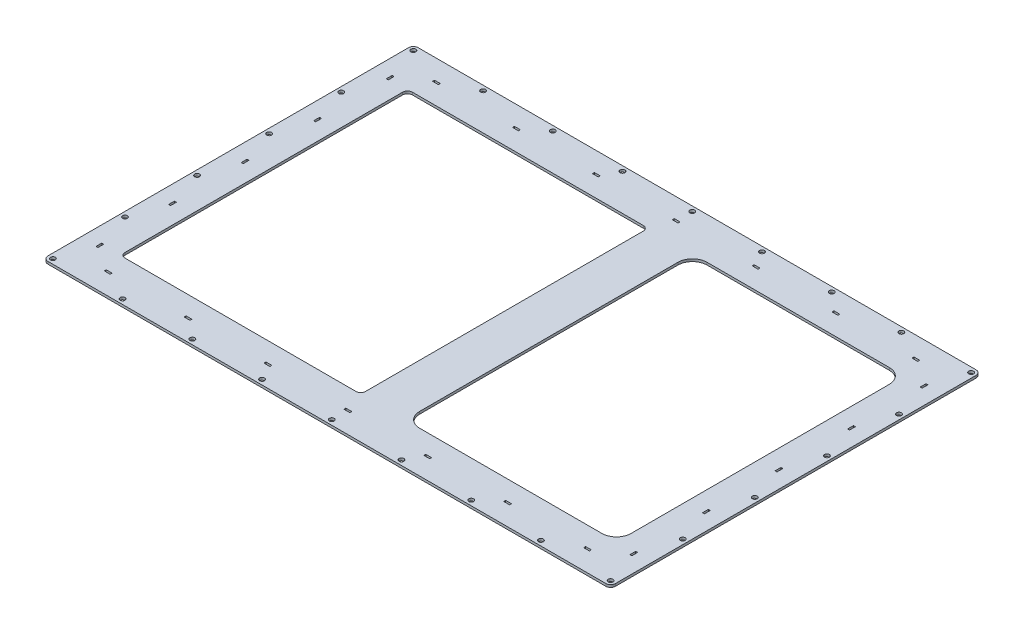
from build123d import *

# Parameters (mm, degrees)
SKETCH_1_W                  = 1165
SKETCH_1_H                  = 760
SKETCH_1_W_2                = 494
SKETCH_1_H_2                = 590
SKETCH_1_W_3                = 434
EXTRUDE_1_DEPTH             = 2.5
FILLET_1_R                  = 10
FILLET_2_R                  = 30
SKETCH_2_R                  = 5
CUT_EXTRUDE_1_DEPTH         = 696.507907935
PATTERN_LINEAR_1_COUNT      = 6
PATTERN_LINEAR_1_PITCH      = 148
PATTERN_LINEAR_1_COUNT_DIR2 = 9
PATTERN_LINEAR_1_PITCH_DIR2 = 143.125
SKETCH_3_W                  = 12
SKETCH_3_H                  = 4
SKETCH_3_W_2                = 4
SKETCH_3_H_2                = 12
CUT_EXTRUDE_2_DEPTH         = 696.507907935


with BuildPart() as part:
    # Эскиз1 → Бобышка-Вытянуть1 (new, symmetric)
    with BuildSketch(Plane(origin=(0, 0, 0), x_dir=(1, 0, 0), z_dir=(0, 1, 0))):
        Rectangle(SKETCH_1_W, SKETCH_1_H)
        with Locations((-262.5, 0)):
            Rectangle(SKETCH_1_W_2, SKETCH_1_H_2, mode=Mode.SUBTRACT)
        with Locations((292.5, 0)):
            Rectangle(SKETCH_1_W_3, SKETCH_1_H_2, mode=Mode.SUBTRACT)
    extrude(amount=EXTRUDE_1_DEPTH, both=True)

    # Скругление1
    fillet_1_edges = [part.edges().sort_by_distance(p)[0] for p in [
        (582.5, 0, 380),
        (-582.5, 0, 380),
        (582.5, 0, -380),
        (-582.5, 0, -380),
        (-15.5, 0, 295),
        (-509.5, 0, 295),
        (-15.5, 0, -295),
        (-509.5, 0, -295),
    ]]
    fillet(fillet_1_edges, radius=FILLET_1_R)

    # Скругление2
    fillet_2_edges = [part.edges().sort_by_distance(p)[0] for p in [
        (75.5, 0, 295),
        (509.5, 0, 295),
        (509.5, 0, -295),
        (75.5, 0, -295),
    ]]
    fillet(fillet_2_edges, radius=FILLET_2_R)

    # Эскиз2 → Вырез-Вытянуть1 (cut, through all)
    with BuildSketch(Plane(origin=(0, 2.5, 0), x_dir=(1, 0, 0), z_dir=(0, 1, 0))):
        with Locations((-572.5, -370)):
            Circle(SKETCH_2_R)
    cut_extrude_1 = extrude(amount=-CUT_EXTRUDE_1_DEPTH, mode=Mode.SUBTRACT)

    # Линейный массив1: Cut-Extrude 1 6 × 9, 25 skipped
    with Locations(*[(j * PATTERN_LINEAR_1_PITCH_DIR2, 0, -i * PATTERN_LINEAR_1_PITCH) for i in range(PATTERN_LINEAR_1_COUNT) for j in range(PATTERN_LINEAR_1_COUNT_DIR2) if (i, j) not in ((0, 0), (1, 1), (1, 2), (1, 3), (1, 4), (1, 5), (1, 6), (1, 7), (2, 1), (2, 2), (2, 3), (2, 4), (2, 5), (2, 6), (2, 7), (3, 1), (3, 2), (3, 3), (3, 4), (3, 5), (3, 6), (3, 7), (4, 1), (4, 2), (4, 3), (4, 4))]):
        add(cut_extrude_1, mode=Mode.SUBTRACT)

    # Эскиз3 → Вырез-Вытянуть2 (cut, through all)
    with BuildSketch(Plane(origin=(0, 2.5, 0), x_dir=(1, 0, 0), z_dir=(0, 1, 0))):
        with Locations((492, 337)):
            Rectangle(SKETCH_3_W, SKETCH_3_H)
        with Locations((328, 337)):
            Rectangle(SKETCH_3_W, SKETCH_3_H)
        with Locations((0, 337)):
            Rectangle(SKETCH_3_W, SKETCH_3_H)
        with Locations((164, 337)):
            Rectangle(SKETCH_3_W, SKETCH_3_H)
        with Locations((-492, 337)):
            Rectangle(SKETCH_3_W, SKETCH_3_H)
        with Locations((-164, 337)):
            Rectangle(SKETCH_3_W, SKETCH_3_H)
        with Locations((-328, 337)):
            Rectangle(SKETCH_3_W, SKETCH_3_H)
        with Locations((492, -337)):
            Rectangle(SKETCH_3_W, SKETCH_3_H)
        with Locations((328, -337)):
            Rectangle(SKETCH_3_W, SKETCH_3_H)
        with Locations((0, -337)):
            Rectangle(SKETCH_3_W, SKETCH_3_H)
        with Locations((164, -337)):
            Rectangle(SKETCH_3_W, SKETCH_3_H)
        with Locations((-492, -337)):
            Rectangle(SKETCH_3_W, SKETCH_3_H)
        with Locations((-164, -337)):
            Rectangle(SKETCH_3_W, SKETCH_3_H)
        with Locations((-328, -337)):
            Rectangle(SKETCH_3_W, SKETCH_3_H)
        with Locations((-548, 149)):
            Rectangle(SKETCH_3_W_2, SKETCH_3_H_2)
        with Locations((-548, 298)):
            Rectangle(SKETCH_3_W_2, SKETCH_3_H_2)
        with Locations((-548, -149)):
            Rectangle(SKETCH_3_W_2, SKETCH_3_H_2)
        with Locations((-548, 0)):
            Rectangle(SKETCH_3_W_2, SKETCH_3_H_2)
        with Locations((-548, -298)):
            Rectangle(SKETCH_3_W_2, SKETCH_3_H_2)
        with Locations((548, -149)):
            Rectangle(SKETCH_3_W_2, SKETCH_3_H_2)
        with Locations((548, -298)):
            Rectangle(SKETCH_3_W_2, SKETCH_3_H_2)
        with Locations((548, 149)):
            Rectangle(SKETCH_3_W_2, SKETCH_3_H_2)
        with Locations((548, 0)):
            Rectangle(SKETCH_3_W_2, SKETCH_3_H_2)
        with Locations((548, 298)):
            Rectangle(SKETCH_3_W_2, SKETCH_3_H_2)
    extrude(amount=-CUT_EXTRUDE_2_DEPTH, mode=Mode.SUBTRACT)


solid = part.part
